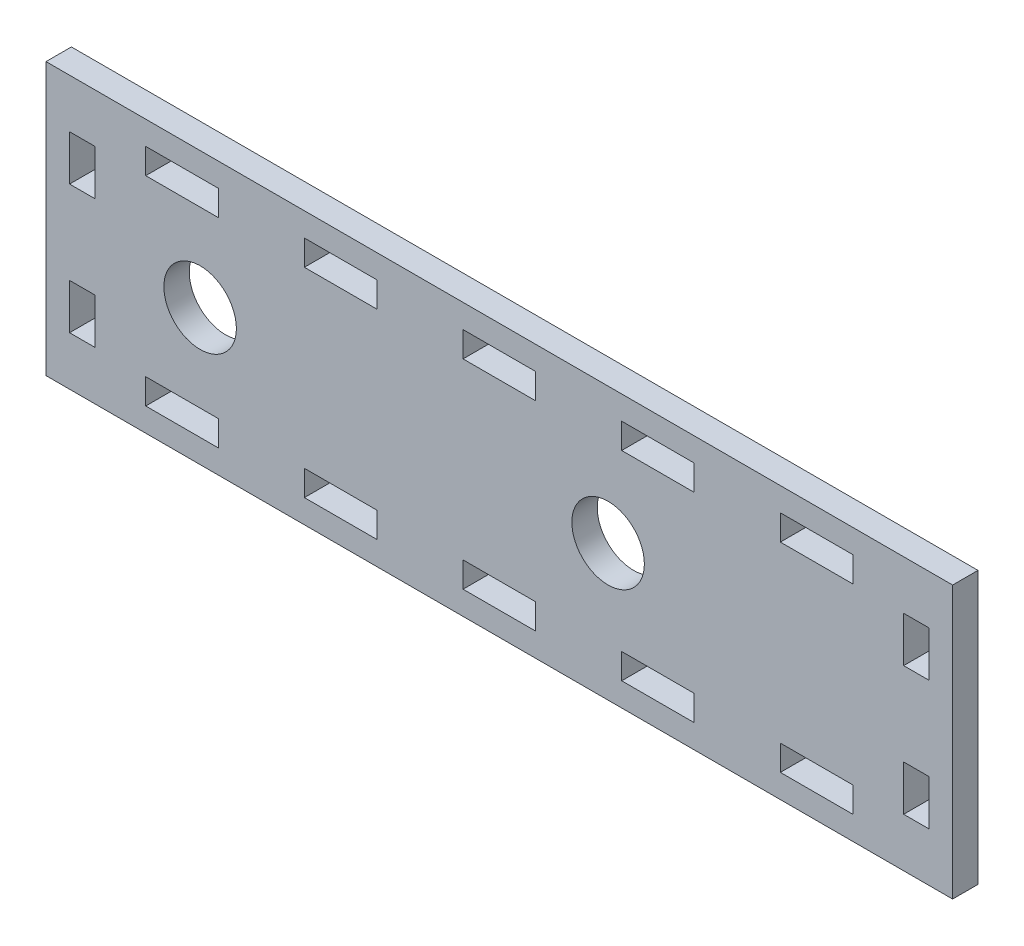
from build123d import *

# Parameters (mm, degrees)
SKETCH_1_W      = 100
SKETCH_1_H      = 30
SKETCH_1_W_2    = 8
SKETCH_1_H_2    = 2.8
SKETCH_1_W_3    = 2.8
SKETCH_1_H_3    = 5
SKETCH_1_R      = 4
EXTRUDE_1_DEPTH = 1.4


with BuildPart() as part:
    # Эскиз1 → Бобышка-Вытянуть1 (new, symmetric)
    with BuildSketch(Plane.XY):
        Rectangle(SKETCH_1_W, SKETCH_1_H)
        with Locations((-35, -11)):
            Rectangle(SKETCH_1_W_2, SKETCH_1_H_2, mode=Mode.SUBTRACT)
        with Locations((-17.5, -11)):
            Rectangle(SKETCH_1_W_2, SKETCH_1_H_2, mode=Mode.SUBTRACT)
        with Locations((-46, -7.1)):
            Rectangle(SKETCH_1_W_3, SKETCH_1_H_3, mode=Mode.SUBTRACT)
        with Locations((-33, 0)):
            Circle(SKETCH_1_R, mode=Mode.SUBTRACT)
        with Locations((0, -11)):
            Rectangle(SKETCH_1_W_2, SKETCH_1_H_2, mode=Mode.SUBTRACT)
        with Locations((17.5, -11)):
            Rectangle(SKETCH_1_W_2, SKETCH_1_H_2, mode=Mode.SUBTRACT)
        with Locations((35, -11)):
            Rectangle(SKETCH_1_W_2, SKETCH_1_H_2, mode=Mode.SUBTRACT)
        with Locations((12, 0)):
            Circle(SKETCH_1_R, mode=Mode.SUBTRACT)
        with Locations((46, -7.1)):
            Rectangle(SKETCH_1_W_3, SKETCH_1_H_3, mode=Mode.SUBTRACT)
        with Locations((-46, 7.1)):
            Rectangle(SKETCH_1_W_3, SKETCH_1_H_3, mode=Mode.SUBTRACT)
        with Locations((-35, 11)):
            Rectangle(SKETCH_1_W_2, SKETCH_1_H_2, mode=Mode.SUBTRACT)
        with Locations((-17.5, 11)):
            Rectangle(SKETCH_1_W_2, SKETCH_1_H_2, mode=Mode.SUBTRACT)
        with Locations((46, 7.1)):
            Rectangle(SKETCH_1_W_3, SKETCH_1_H_3, mode=Mode.SUBTRACT)
        with Locations((0, 11)):
            Rectangle(SKETCH_1_W_2, SKETCH_1_H_2, mode=Mode.SUBTRACT)
        with Locations((17.5, 11)):
            Rectangle(SKETCH_1_W_2, SKETCH_1_H_2, mode=Mode.SUBTRACT)
        with Locations((35, 11)):
            Rectangle(SKETCH_1_W_2, SKETCH_1_H_2, mode=Mode.SUBTRACT)
    extrude(amount=EXTRUDE_1_DEPTH, both=True)


solid = part.part
